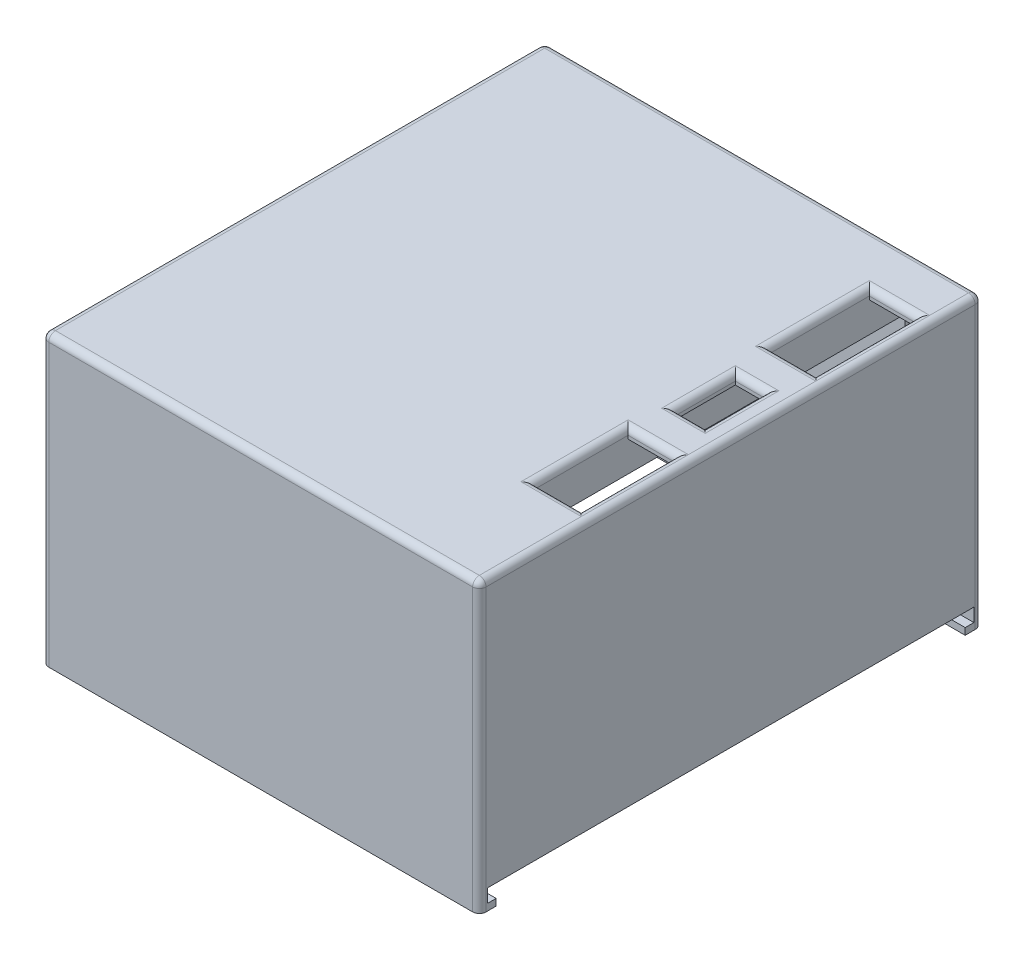
from build123d import *

# Parameters (mm, degrees)
SKETCH1_W               = 65.26
SKETCH1_H               = 75
BOSS_EXTRUDE1_DEPTH     = 43
CUT_EXTRUDE1_DEPTH      = 35
CUT_EXTRUDE1_DEPTH_BACK = 35
SKETCH4_W               = 7
SKETCH4_H               = 1.7
CUT_EXTRUDE2_DEPTH      = 41.5
SKETCH5_W               = 7
SKETCH5_H               = 14
SKETCH5_H_2             = 15
SKETCH5_W_2             = 4.5
SKETCH5_H_3             = 9
CUT_EXTRUDE3_DEPTH      = 65.755053085
SKETCH7_W               = 6
SKETCH7_H               = 12
CUT_EXTRUDE4_DEPTH      = 92.75705368
FILLET1_R               = 1
BOSS_EXTRUDE2_DEPTH     = 10
CUT_EXTRUDE5_DEPTH      = 20
CUT_EXTRUDE5_DEPTH_BACK = 20
SKETCH12_W              = 72.6
SKETCH12_H              = 2
CUT_EXTRUDE6_DEPTH      = 64
SKETCH13_W              = 6.500006658
SKETCH13_H              = 70
CUT_EXTRUDE7_DEPTH      = 3
BOSS_EXTRUDE3_DEPTH     = 7
SKETCH17_R              = 2
CUT_EXTRUDE9_DEPTH      = 2.5


with BuildPart() as part:
    # Sketch1 → Boss-Extrude1 (new body)
    with BuildSketch(Plane(origin=(0, 0, 0), x_dir=(1, 0, 0), z_dir=(0, 1, 0))):
        Rectangle(SKETCH1_W, SKETCH1_H)
    extrude(amount=BOSS_EXTRUDE1_DEPTH)

    # Sketch3 → Cut-Extrude1 (cut, two sides: drawn at the far end of the back side and taken through both)
    with BuildSketch(Plane.XY.offset(-CUT_EXTRUDE1_DEPTH_BACK)):
        with BuildLine():
            Line((30.629993342, 0), (-30.63, 0))
            Line((-30.63, 0), (-30.63, 31.95))
            ThreePointArc((-30.63, 31.95), (-24.219797365, 40.606440947), (-14.070006658, 37))
            Line((-14.070006658, 37), (-10.739993342, 37))
            ThreePointArc((-10.739993342, 37), (-3.23, 41), (4.279993342, 37))
            Line((4.279993342, 37), (7.610006658, 37))
            ThreePointArc((7.610006658, 37), (15.12, 41), (22.629993342, 37))
            Line((22.629993342, 37), (23.629993342, 37))
            Line((23.629993342, 37), (23.629993342, 41.5))
            Line((23.629993342, 41.5), (30.629993342, 41.5))
            Line((30.629993342, 41.5), (30.629993342, 0))
        make_face()
    extrude(amount=CUT_EXTRUDE1_DEPTH + CUT_EXTRUDE1_DEPTH_BACK, mode=Mode.SUBTRACT)

    # Sketch4 → Cut-Extrude2 (cut)
    with BuildSketch(Plane(origin=(0, 0, 0), x_dir=(-1, 0, 0), z_dir=(0, -1, 0))):
        with Locations((-27.129993342, 35.85)):
            Rectangle(SKETCH4_W, SKETCH4_H)
    extrude(amount=-CUT_EXTRUDE2_DEPTH, mode=Mode.SUBTRACT)

    # Sketch5 → Cut-Extrude3 (cut, through all)
    with BuildSketch(Plane(origin=(0, 41.5, 0), x_dir=(-1, 0, 0), z_dir=(0, -1, 0))):
        with Locations((-27.129993342, -13.3)):
            Rectangle(SKETCH5_W, SKETCH5_H)
        with Locations((-27.129993342, 22.2)):
            Rectangle(SKETCH5_W, SKETCH5_H_2)
        with Locations((-26.879993342, 4.2)):
            Rectangle(SKETCH5_W_2, SKETCH5_H_3)
    extrude(amount=-CUT_EXTRUDE3_DEPTH, mode=Mode.SUBTRACT)

    # Sketch7 → Cut-Extrude4 (cut, through all)
    with BuildSketch(Plane.XY.offset(-36.7)):
        with BuildLine():
            Line((23.629993342, 29.5), (30.629993342, 29.5))
            Line((30.629993342, 29.5), (30.629993342, 32))
            Line((30.629993342, 32), (29.323734439, 32))
            ThreePointArc((29.323734439, 32), (27.129993342, 30.25), (24.936252245, 32))
            Line((24.936252245, 32), (23.629993342, 32))
            Line((23.629993342, 32), (23.629993342, 29.5))
        make_face()
        with BuildLine():
            Line((23.629993342, 35.5), (30.629993342, 35.5))
            Line((30.629993342, 35.5), (30.629993342, 33))
            Line((30.629993342, 33), (29.323734439, 33))
            ThreePointArc((29.323734439, 33), (27.129993342, 34.75), (24.936252245, 33))
            Line((24.936252245, 33), (23.629993342, 33))
            Line((23.629993342, 33), (23.629993342, 35.5))
        make_face()
        with Locations((27.629993342, 20.5)):
            Rectangle(SKETCH7_W, SKETCH7_H)
    extrude(amount=-CUT_EXTRUDE4_DEPTH, mode=Mode.SUBTRACT)

    # Fillet1
    fillet1_edges = [part.edges().sort_by_distance(p)[0] for p in [
        (0, 43, -37.5),
        (32.63, 43, 0),
        (0, 43, 37.5),
        (-32.63, 43, 0),
        (29.129993342, 43, -4.2),
        (26.879993342, 43, -8.7),
        (24.629993342, 43, -4.2),
        (26.879993342, 43, 0.3),
        (30.629993342, 43, -22.2),
        (27.129993342, 43, -29.7),
        (23.629993342, 43, -22.2),
        (27.129993342, 43, -14.7),
        (30.629993342, 43, 13.3),
        (27.129993342, 43, 6.3),
        (23.629993342, 43, 13.3),
        (27.129993342, 43, 20.3),
        (32.63, 21.5, 37.5),
        (32.63, 21.5, -37.5),
        (-32.63, 21.5, 37.5),
        (-32.63, 21.5, -37.5),
    ]]
    fillet(fillet1_edges, radius=FILLET1_R - 0.0001)  # a hair under: the kernel refuses the full size

    # Sketch8 → Boss-Extrude2 (add)
    with BuildSketch(Plane(origin=(0, 0, 0), x_dir=(-1, 0, 0), z_dir=(0, -1, 0))):
        with BuildLine():
            Line((-30.629993342, 7), (-29.129993342, 7))
            ThreePointArc((-29.129993342, 7), (-26.129993342, 10), (-29.129993342, 13))
            Line((-29.129993342, 13), (-30.629993342, 13))
            Line((-30.629993342, 13), (-30.629993342, 7))
        make_face()
        with BuildLine():
            Line((-30.629993342, -13), (-29.129993342, -13))
            ThreePointArc((-29.129993342, -13), (-26.129993342, -10), (-29.129993342, -7))
            Line((-29.129993342, -7), (-30.629993342, -7))
            Line((-30.629993342, -7), (-30.629993342, -13))
        make_face()
    extrude(amount=-BOSS_EXTRUDE2_DEPTH)

    # Sketch11 → Cut-Extrude5 (cut, two sides: drawn at the far end of the back side and taken through both)
    with BuildSketch(Plane.XY.offset(-CUT_EXTRUDE5_DEPTH_BACK)):
        Polygon((30.629993342, 10), (26.129993342, 6), (26.129993342, 10), align=None)
    extrude(amount=CUT_EXTRUDE5_DEPTH + CUT_EXTRUDE5_DEPTH_BACK, mode=Mode.SUBTRACT)

    # Sketch12 → Cut-Extrude6 (cut)
    with BuildSketch(Plane(origin=(32.63, 0, 0), x_dir=(0, 0, -1), z_dir=(1, 0, 0))):
        with Locations((0, 2)):
            Rectangle(SKETCH12_W, SKETCH12_H)
    extrude(amount=-CUT_EXTRUDE6_DEPTH, mode=Mode.SUBTRACT)

    # Sketch13 → Cut-Extrude7 (cut)
    with BuildSketch(Plane.XZ):
        with Locations((29.379996671, 0)):
            Rectangle(SKETCH13_W, SKETCH13_H)
    extrude(amount=-CUT_EXTRUDE7_DEPTH, mode=Mode.SUBTRACT)

    # Sketch15 → Boss-Extrude3 (add)
    with BuildSketch(Plane(origin=(23.629993342, 0, 0), x_dir=(0, 0, -1), z_dir=(1, 0, 0))):
        Polygon((36.7, 0), (36.7, 3), (36.3, 3), (36.3, 1), (35, 1), (35, 0), align=None)
    extrude(amount=BOSS_EXTRUDE3_DEPTH)

    # Sketch17 → Cut-Extrude9 (cut)
    with BuildSketch(Plane(origin=(0, 3, 0), x_dir=(-1, 0, 0), z_dir=(0, -1, 0))):
        with Locations(Location((-29.129993342, 10, 0), (0, 0, 90))):
            Circle(SKETCH17_R)
        with Locations(Location((-29.129993342, -10, 0), (0, 0, 90))):
            Circle(SKETCH17_R)
    extrude(amount=-CUT_EXTRUDE9_DEPTH, mode=Mode.SUBTRACT)


solid = part.part
